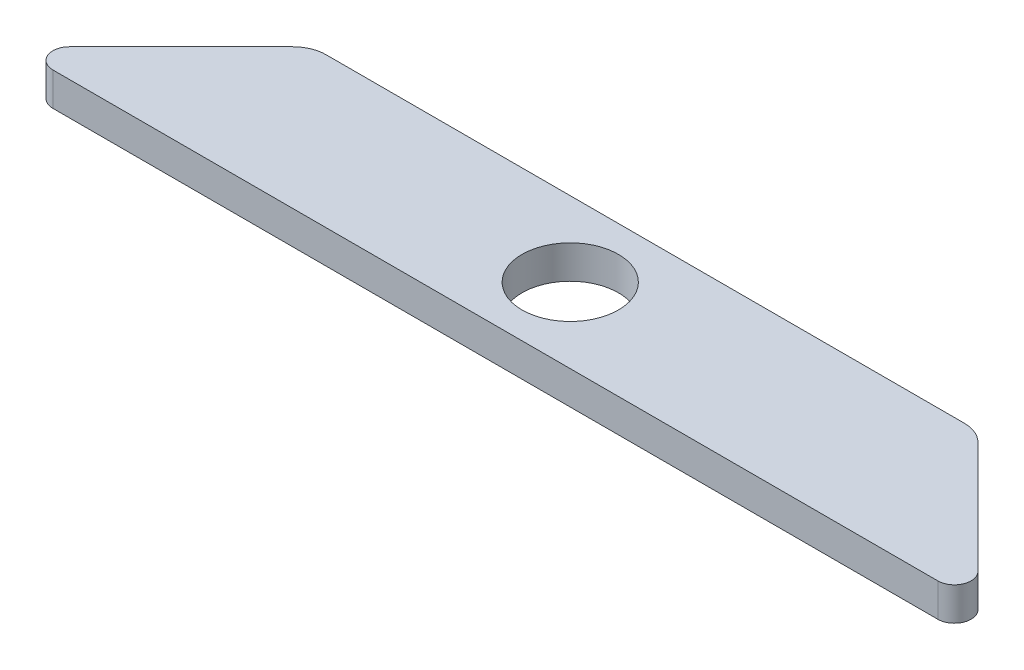
from build123d import *

# Parameters (mm, degrees)
BOSS_EXTRUDE1_DEPTH = 0.5
CUT_EXTRUDE1_REACH  = 16.059
SKETCH2_R           = 1.4478


with BuildPart() as part:
    # Sketch1 → Boss-Extrude1 (new, symmetric)
    with BuildSketch(Plane(origin=(0, 0, 0), x_dir=(1, 0, 0), z_dir=(0, 1, 0))):
        with BuildLine():
            Line((-13.292893219, -2.530330086), (13.292893219, -2.530330086))
            ThreePointArc((13.292893219, -2.530330086), (13.754832985, -2.221671802), (13.646446609, -1.676776695))
            Line((13.646446609, -1.676776695), (10.292893219, 1.676776695))
            ThreePointArc((10.292893219, 1.676776695), (9.96846987, 1.893549447), (9.585786438, 1.969669914))
            Line((9.585786438, 1.969669914), (-9.585786438, 1.969669914))
            ThreePointArc((-9.585786438, 1.969669914), (-9.96846987, 1.893549447), (-10.292893219, 1.676776695))
            Line((-10.292893219, 1.676776695), (-13.646446609, -1.676776695))
            ThreePointArc((-13.646446609, -1.676776695), (-13.754832985, -2.221671802), (-13.292893219, -2.530330086))
        make_face()
    extrude(amount=BOSS_EXTRUDE1_DEPTH, both=True)

    # Sketch2 → Cut-Extrude1 (cut, up to next)
    with BuildSketch(Plane(origin=(0, 0.5, 0), x_dir=(1, 0, 0), z_dir=(0, 1, 0)), mode=Mode.PRIVATE) as cut_extrude1_sk1:
        with Locations((0, -0.280330086)):
            Circle(SKETCH2_R)
    cut_extrude1_tool1 = extrude(cut_extrude1_sk1.sketch, amount=-CUT_EXTRUDE1_REACH, mode=Mode.PRIVATE) & part.part
    add(cut_extrude1_tool1.solids().sort_by_distance((0, 0.5, 0.28033))[0], mode=Mode.SUBTRACT)


solid = part.part
